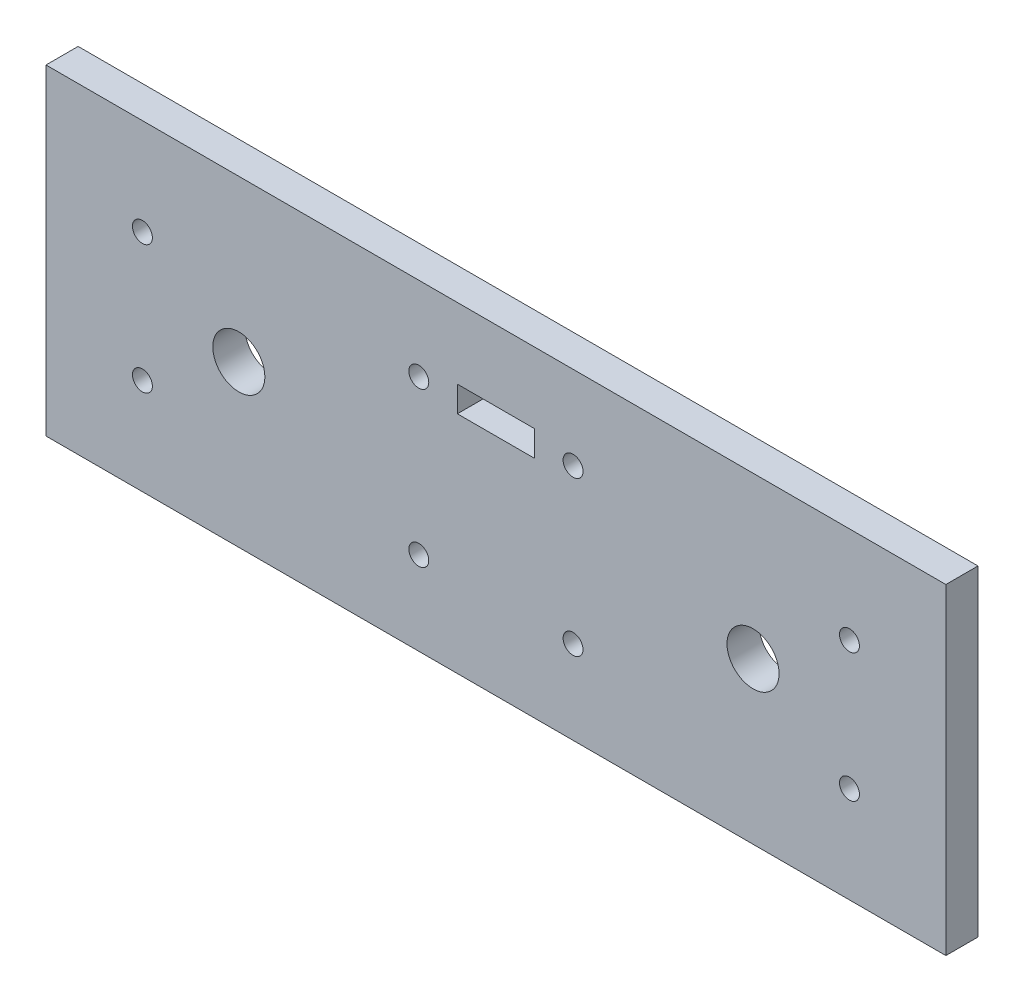
from build123d import *

# Parameters (mm, degrees)
ESQUISSE1_W        = 140
ESQUISSE1_H        = 50
ESQUISSE1_R        = 4.05
ESQUISSE1_R_2      = 1.55
ESQUISSE1_W_2      = 12
ESQUISSE1_H_2      = 4
BOSS_EXTRU_1_DEPTH = 5


with BuildPart() as part:
    # Esquisse1 → Boss.-Extru.1 (new body)
    with BuildSketch(Plane.XY):
        Rectangle(ESQUISSE1_W, ESQUISSE1_H)
        with Locations((-40, 0)):
            Circle(ESQUISSE1_R, mode=Mode.SUBTRACT)
        with Locations((-55, -10)):
            Circle(ESQUISSE1_R_2, mode=Mode.SUBTRACT)
        with Locations((-55, 10)):
            Circle(ESQUISSE1_R_2, mode=Mode.SUBTRACT)
        with Locations((55, -10)):
            Circle(ESQUISSE1_R_2, mode=Mode.SUBTRACT)
        with Locations((55, 10)):
            Circle(ESQUISSE1_R_2, mode=Mode.SUBTRACT)
        with Locations((40, 0)):
            Circle(ESQUISSE1_R, mode=Mode.SUBTRACT)
        with Locations((-12, 12)):
            Circle(ESQUISSE1_R_2, mode=Mode.SUBTRACT)
        with Locations((-12, -12)):
            Circle(ESQUISSE1_R_2, mode=Mode.SUBTRACT)
        with Locations((12, -12)):
            Circle(ESQUISSE1_R_2, mode=Mode.SUBTRACT)
        with Locations((12, 12)):
            Circle(ESQUISSE1_R_2, mode=Mode.SUBTRACT)
        with Locations((0, 12)):
            Rectangle(ESQUISSE1_W_2, ESQUISSE1_H_2, mode=Mode.SUBTRACT)
    extrude(amount=-BOSS_EXTRU_1_DEPTH)


solid = part.part
